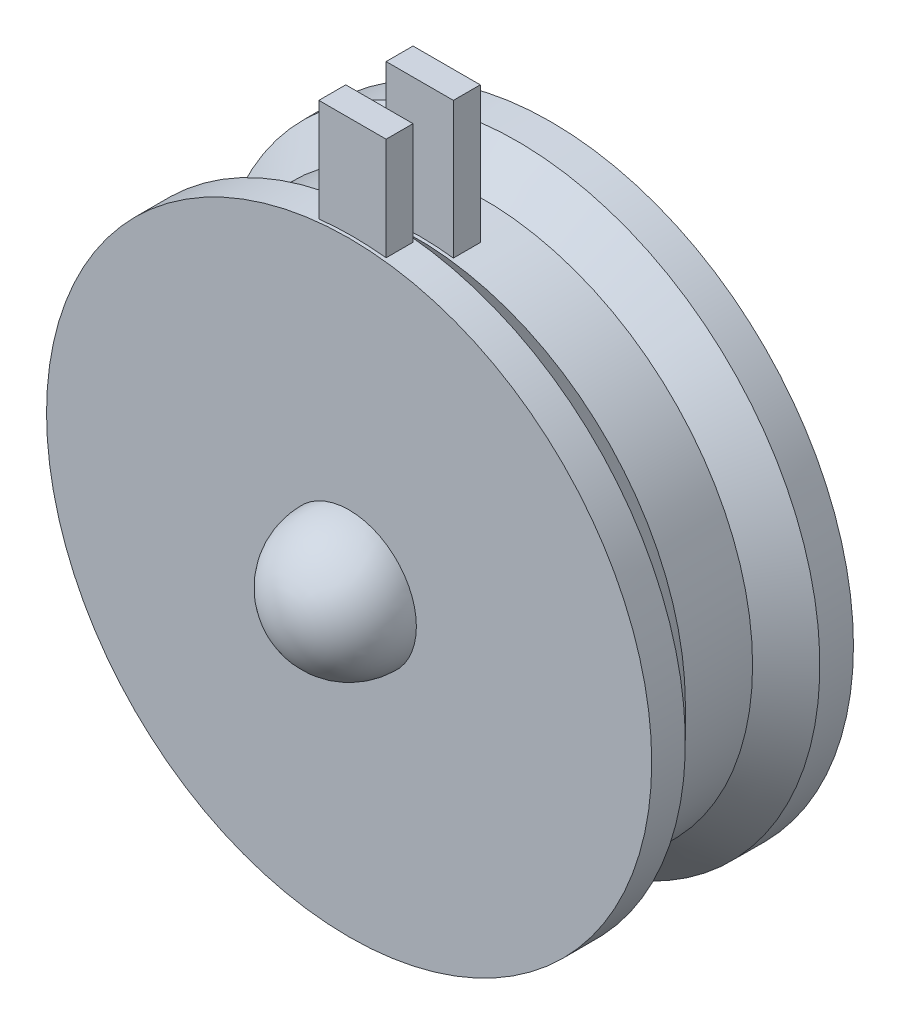
from build123d import *

# Parameters (mm, degrees)
SKETCH1_R                = 4.5
MAIN_BASE_DEPTH          = 3
BOSS_EXTRUDE1_DEPTH      = 0.5
BOSS_EXTRUDE1_DEPTH_BACK = 0.5
SKETCH5_W                = 0.4
SKETCH5_H                = 2
SKETCH5_H_2              = 2.5


with BuildPart() as part:
    # Sketch1 → main_base (new body)
    with BuildSketch(Plane.XY):
        Circle(SKETCH1_R)
    extrude(amount=MAIN_BASE_DEPTH)

    # Sketch2 → pulley_cut_out (revolve, cut)
    with BuildSketch(Plane(origin=(0, 0, 0), x_dir=(0, 0, -1), z_dir=(1, 0, 0))):
        Polygon((-2.5, 4.5), (-0.5, 4.5), (-1, 4), (-2, 4), align=None)
    revolve(axis=Axis((0, 0, 0), (0, 0, 1)), mode=Mode.SUBTRACT)

    # Sketch4 → rotating_point (revolve)
    with BuildSketch(Plane(origin=(0, 0, 0), x_dir=(1, 0, 0), z_dir=(0, 1, 0))):
        with BuildLine():
            ThreePointArc((0, 1), (-0.707106781, 0.707106781), (-1, 0))
            Line((-1, 0), (0, 0))
            Line((0, 0), (0, 1))
        make_face()
        with BuildLine():
            Line((0, -4), (0, -3))
            Line((0, -3), (-1, -3))
            ThreePointArc((-1, -3), (-0.707106781, -3.707106781), (0, -4))
        make_face()
    revolve(axis=Axis((0, 0, -1), (0, 0, 1)))

    # Sketch5 → Boss-Extrude1 (add, two sides: drawn at the far end of the back side and taken through both)
    with BuildSketch(Plane(origin=(0, 0, 0), x_dir=(0, 0, -1), z_dir=(1, 0, 0)).offset(-BOSS_EXTRUDE1_DEPTH_BACK)):
        with Locations((-2.75, 5)):
            Rectangle(SKETCH5_W, SKETCH5_H)
        with Locations((-1.75, 4.75)):
            Rectangle(SKETCH5_W, SKETCH5_H_2)
    extrude(amount=BOSS_EXTRUDE1_DEPTH + BOSS_EXTRUDE1_DEPTH_BACK)


solid = part.part
